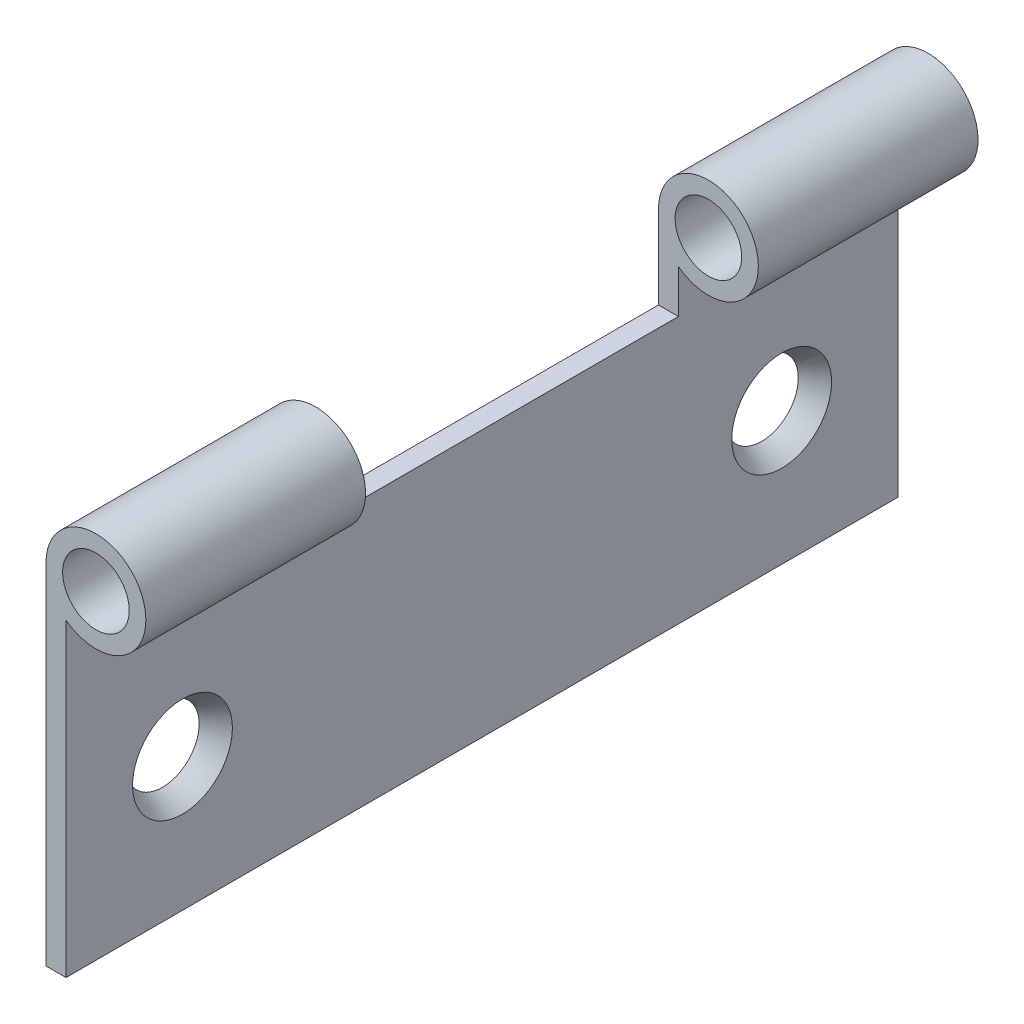
from build123d import *

# Parameters (mm, degrees)
SKETCH_1_W          = 0.6
SKETCH_1_H          = 10.5
EXTRUDE_1_DEPTH     = 12.5
SKETCH_2_R          = 1.5
SKETCH_3_R          = 1
CUT_EXTRUDE_1_DEPTH = 28.892651362
SKETCH_10_W         = 11.8
SKETCH_10_H         = 6
CUT_EXTRUDE_4_DEPTH = 60


with BuildPart() as part:
    # 草图1 → 拉伸-薄壁1 (new, symmetric)
    with BuildSketch(Plane.XY):
        with Locations((0.3, 5.25)):
            Rectangle(SKETCH_1_W, SKETCH_1_H)
    extrude(amount=EXTRUDE_1_DEPTH, both=True)

    # 扫描1: sweep along a curve in space
    with BuildLine() as sweep_1_path:
        Line((0.6, 10.5, 12.5), (0.6, 10.5, -12.5))
    # 草图2 → 扫描1 (sweep)
    with BuildSketch(Plane.XY.offset(12.5)):
        with Locations((1.5, 10.5)):
            Circle(SKETCH_2_R)
    sweep(path=sweep_1_path.line)

    # 草图3 → 切除-拉伸1 (cut, through all)
    with BuildSketch(Plane.XY.offset(12.5)):
        with Locations((1.5, 10.5)):
            Circle(SKETCH_3_R)
    extrude(amount=-CUT_EXTRUDE_1_DEPTH, mode=Mode.SUBTRACT)

    # 草图10 → 切除-拉伸4 (cut, symmetric)
    with BuildSketch(Plane(origin=(0.6, 0, 0), x_dir=(0, 0, -1), z_dir=(1, 0, 0))):
        with Locations((0, 11)):
            Rectangle(SKETCH_10_W, SKETCH_10_H)
    extrude(amount=CUT_EXTRUDE_4_DEPTH, both=True, mode=Mode.SUBTRACT)

    # 切除-放样1: read off the stored shape, not the designer's step
    # 切除-放样1: loft between two sections, ruled curve by curve
    loft_1_from = [
        Edge.make_bspline([(0, 4.274228258, 10.065269385), (0, 2.143689489, 10.613725902), (0, 1.595232972, 8.483187132), (0, 3.725771742, 7.934730615), (0, 5.856310511, 7.386274098), (0, 6.404767028, 9.516812868), (0, 4.274228258, 10.065269385)], [0, 0, 0, 0, 0.5, 0.5, 0.5, 1, 1, 1, 1], 3, [1, 0.333333333, 0.333333333, 1, 0.333333333, 0.333333333, 1]),
    ]
    loft_1_to = [
        Edge.make_bspline([(0.6, 4.815640724, 10.258860679), (0.6, 2.297919366, 11.890142127), (0.6, 0.666637918, 9.372420769), (0.6, 3.184359276, 7.741139321), (0.6, 5.702080634, 6.109857873), (0.6, 7.333362082, 8.627579231), (0.6, 4.815640724, 10.258860679)], [0, 0, 0, 0, 0.5, 0.5, 0.5, 1, 1, 1, 1], 3, [1, 0.333333333, 0.333333333, 1, 0.333333333, 0.333333333, 1]),
    ]
    loft_1 = Solid(Shell([*[Face.make_surface_from_curves(loft_1_from[k], loft_1_to[k]) for k in range(1)], Face(Wire(loft_1_from)), Face(Wire(loft_1_to))]))
    add(loft_1, mode=Mode.SUBTRACT)

    # 镜向1: 切除-放样1 across plane
    add(loft_1.mirror(Plane.XY), mode=Mode.SUBTRACT)


solid = part.part
